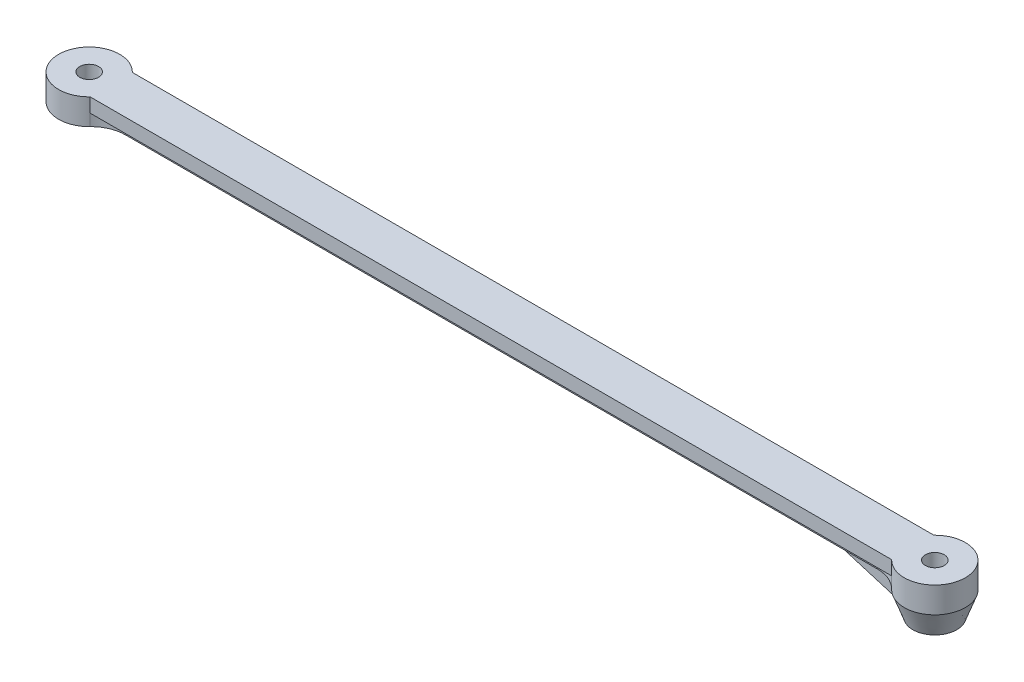
from build123d import *

# Parameters (mm, degrees)
SKETCH1_R           = 2
BOSS_EXTRUDE1_DEPTH = 5.5
CUT_EXTRUDE1_DEPTH  = 2.5
SKETCH4_R           = 6.5
SKETCH3_R           = 4.68
SKETCH5_R           = 2
CUT_EXTRUDE2_DEPTH  = 187.908400029
BOSS_EXTRUDE2_DEPTH = 1.25


with BuildPart() as part:
    # Sketch1 → Boss-Extrude1 (new body)
    with BuildSketch(Plane(origin=(0, 0, 0), x_dir=(1, 0, 0), z_dir=(0, 1, 0))):
        with BuildLine():
            Line((-175.30958424, 4.5), (-4.69041576, 4.5))
            ThreePointArc((-4.69041576, 4.5), (6.5, 0), (-4.69041576, -4.5))
            Line((-4.69041576, -4.5), (-175.30958424, -4.5))
            ThreePointArc((-175.30958424, -4.5), (-186.5, 0), (-175.30958424, 4.5))
        make_face()
        Circle(SKETCH1_R, mode=Mode.SUBTRACT)
        with Locations((-180, 0)):
            Circle(SKETCH1_R, mode=Mode.SUBTRACT)
    extrude(amount=BOSS_EXTRUDE1_DEPTH)

    # Sketch2 → Cut-Extrude1 (cut)
    with BuildSketch(Plane.XZ):
        with BuildLine():
            Line((-9.96713349, 2.25), (-170.03286651, 2.25))
            ThreePointArc((-170.03286651, 2.25), (-172.901064987, 2.835978332), (-175.30958424, 4.5))
            Line((-175.30958424, 4.5), (-4.69041576, 4.5))
            ThreePointArc((-4.69041576, 4.5), (-7.098935013, 2.835978332), (-9.96713349, 2.25))
        make_face()
        with BuildLine():
            Line((-9.96713349, -2.25), (-170.03286651, -2.25))
            ThreePointArc((-170.03286651, -2.25), (-172.901064987, -2.835978332), (-175.30958424, -4.5))
            Line((-175.30958424, -4.5), (-4.69041576, -4.5))
            ThreePointArc((-4.69041576, -4.5), (-7.098935013, -2.835978332), (-9.96713349, -2.25))
        make_face()
    extrude(amount=-CUT_EXTRUDE1_DEPTH, mode=Mode.SUBTRACT)

    # Sketch4 → Loft1 section 0
    with BuildSketch(Plane.XZ):
        Circle(SKETCH4_R)
    # Sketch3 → Loft1 section 1
    with BuildSketch(Plane(origin=(0, -5, 0), x_dir=(-1, 0, 0), z_dir=(0, -1, 0))):
        Circle(SKETCH3_R)
    loft()

    # Sketch5 → Cut-Extrude2 (cut, through all)
    with BuildSketch(Plane.XZ.offset(5)):
        Circle(SKETCH5_R)
    extrude(amount=-CUT_EXTRUDE2_DEPTH, mode=Mode.SUBTRACT)

    # Sketch6 → Boss-Extrude2 (add, symmetric)
    with BuildSketch(Plane.XY):
        Polygon((-3.080000032, 0), (-21.280000032, 0), (-4.680000032, -5), (-3.080000032, -5), align=None)
    extrude(amount=BOSS_EXTRUDE2_DEPTH, both=True)


solid = part.part
